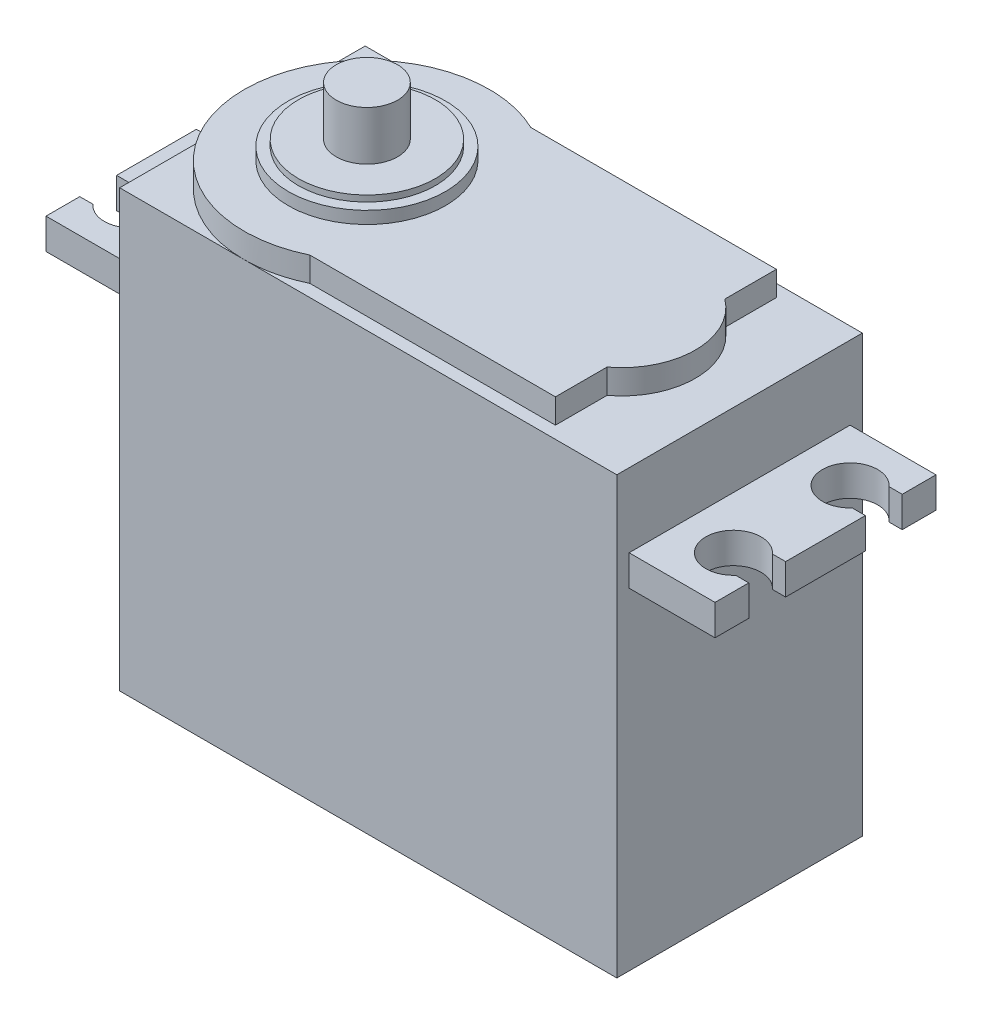
from build123d import *

# Parameters (mm, degrees)
SKETCH1_W            = 40.5
SKETCH1_H            = 20
BOSS_EXTRUDE1_DEPTH  = 35.5
BOSS_EXTRUDE2_DEPTH  = 2
SKETCH3_R            = 6.4
BOSS_EXTRUDE3_DEPTH  = 1
SKETCH4_R            = 5.575
BOSS_EXTRUDE4_DEPTH  = 0.5
BOSS_EXTRUDE5_DEPTH  = 2.5
MIRROR2_COPY_1_DEPTH = 2.5
SKETCH6_R            = 2.5
BOSS_EXTRUDE6_DEPTH  = 4


with BuildPart() as part:
    # Sketch1 → Boss-Extrude1 (new body)
    with BuildSketch(Plane(origin=(0, 0, 0), x_dir=(1, 0, 0), z_dir=(0, 1, 0))):
        Rectangle(SKETCH1_W, SKETCH1_H)
    extrude(amount=BOSS_EXTRUDE1_DEPTH)

    # Sketch2 → Boss-Extrude2 (add)
    with BuildSketch(Plane(origin=(0, 35.5, 0), x_dir=(1, 0, 0), z_dir=(0, 1, 0))):
        with BuildLine():
            Line((-5.75, -9), (14.25, -9))
            Line((14.25, -9), (14.25, -4.8))
            ThreePointArc((14.25, -4.8), (16.65, 0), (14.25, 4.8))
            Line((14.25, 4.8), (14.25, 9))
            Line((14.25, 9), (-5.75, 9))
            ThreePointArc((-5.75, 9), (-20.108898944, 0), (-5.75, -9))
        make_face()
    extrude(amount=BOSS_EXTRUDE2_DEPTH)

    # Sketch3 → Boss-Extrude3 (add)
    with BuildSketch(Plane(origin=(0, 37.5, 0), x_dir=(1, 0, 0), z_dir=(0, 1, 0))):
        with Locations((-10.108898944, 0)):
            Circle(SKETCH3_R)
    extrude(amount=BOSS_EXTRUDE3_DEPTH)

    # Sketch4 → Boss-Extrude4 (add)
    with BuildSketch(Plane(origin=(0, 38.5, 0), x_dir=(1, 0, 0), z_dir=(0, 1, 0))):
        with Locations((-10.108898944, 0)):
            Circle(SKETCH4_R)
    extrude(amount=BOSS_EXTRUDE4_DEPTH)

    # Sketch5 → Boss-Extrude5 (add)
    with BuildSketch(Plane(origin=(0, 29.5, 0), x_dir=(1, 0, 0), z_dir=(0, 1, 0))):
        with BuildLine():
            Line((20.25, 9), (27.25, 9))
            Line((27.25, 9), (27.25, 6.25))
            Line((27.25, 6.25), (26.177050983, 6.25))
            ThreePointArc((26.177050983, 6.25), (22.25, 4.75), (26.177050983, 3.25))
            Line((26.177050983, 3.25), (27.25, 3.25))
            Line((27.25, 3.25), (27.25, 0))
            Line((27.25, 0), (20.25, 0))
            Line((20.25, 0), (20.25, 9))
        make_face()
    boss_extrude5 = extrude(amount=-BOSS_EXTRUDE5_DEPTH)

    # Mirror1: Boss-Extrude5 across plane
    add(boss_extrude5.mirror(Plane(origin=(0, 0, 0), x_dir=(0, 0, 1), z_dir=(1, 0, 0))))

    # Mirror2: Boss-Extrude5 across plane
    add(boss_extrude5.mirror(Plane.XY))

    # Mirror2 copy 1 sketch → Mirror2 copy 1 (add)
    with BuildSketch(Plane(origin=(0, 29.5, 0), x_dir=(-1, 0, 0), z_dir=(0, 1, 0))):
        with BuildLine():
            Line((20.25, 9), (27.25, 9))
            Line((27.25, 9), (27.25, 6.25))
            Line((27.25, 6.25), (26.177050983, 6.25))
            ThreePointArc((26.177050983, 6.25), (22.25, 4.75), (26.177050983, 3.25))
            Line((26.177050983, 3.25), (27.25, 3.25))
            Line((27.25, 3.25), (27.25, 0))
            Line((27.25, 0), (20.25, 0))
            Line((20.25, 0), (20.25, 9))
        make_face()
    extrude(amount=-MIRROR2_COPY_1_DEPTH)

    # Sketch6 → Boss-Extrude6 (add)
    with BuildSketch(Plane(origin=(0, 39, 0), x_dir=(1, 0, 0), z_dir=(0, 1, 0))):
        with Locations((-10.108898944, 0)):
            Circle(SKETCH6_R)
    extrude(amount=BOSS_EXTRUDE6_DEPTH)


solid = part.part
